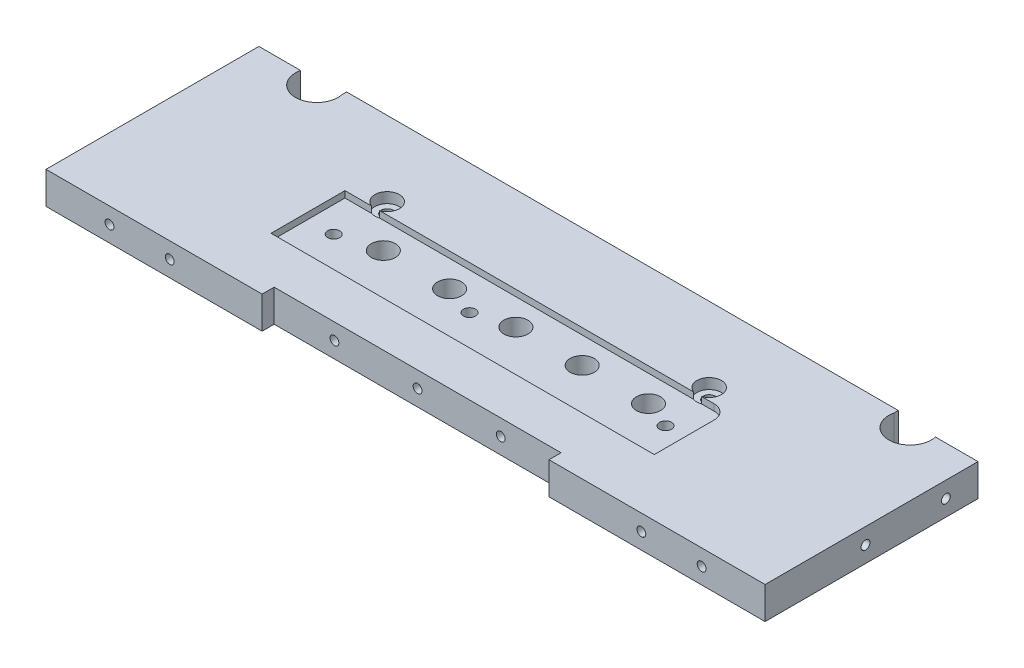
from build123d import *

# Parameters (mm, degrees)
DODANIE_WYCI_GNI_CIE1_DEPTH = 8
SZKIC7_R                    = 1.1
WYTNIJ_WYCI_GNI_CIE3_DEPTH  = 10
WYTNIJ_WYCI_GNI_CIE4_START  = -10
SZKIC8_R                    = 1.1
WYTNIJ_WYCI_GNI_CIE4_DEPTH  = 10
SZKIC9_R                    = 1.1
WYTNIJ_WYCI_GNI_CIE5_DEPTH  = 10
SZKIC11_R                   = 5.3
WYTNIJ_WYCI_GNI_CIE7_DEPTH  = 10
SZKIC12_W                   = 31
SZKIC12_H                   = 15
SZKIC12_W_2                 = 36
SZKIC12_H_2                 = 17
WYTNIJ_WYCI_GNI_CIE8_DEPTH  = 223.433017814
SZKIC13_W                   = 110.4
SZKIC13_H                   = 8
DODANIE_WYCI_GNI_CIE3_DEPTH = 5
SZKIC14_W                   = 137.340188064
SZKIC14_H                   = 8
DODANIE_WYCI_GNI_CIE4_DEPTH = 1.1
DODANIE_WYCI_GNI_CIE5_START = 0.8
SZKIC15_W                   = 53
SZKIC15_H                   = 8
SZKIC15_R                   = 1.1
DODANIE_WYCI_GNI_CIE5_DEPTH = 0.8
SZKIC16_W                   = 53
SZKIC16_H                   = 8
SZKIC16_R                   = 1.1
DODANIE_WYCI_GNI_CIE6_DEPTH = 0.8
GNIAZDO1_START              = 87.470612667
GNIAZDO1_OUTLINE_W          = 8
GNIAZDO1_OUTLINE_H          = 4.7
GNIAZDO1_DEPTH              = 1.6
GNIAZDO1_START_2            = 103.970612667
GNIAZDO1_2_OUTLINE_W        = 8
GNIAZDO1_2_OUTLINE_H        = 4.7
GNIAZDO1_2_DEPTH            = 1.6
GNIAZDO1_START_3            = 120.470612667
GNIAZDO1_3_OUTLINE_W        = 8
GNIAZDO1_3_OUTLINE_H        = 4.7
GNIAZDO1_3_DEPTH            = 1.6
GNIAZDO1_START_4            = 136.970612667
GNIAZDO1_4_OUTLINE_W        = 8
GNIAZDO1_4_OUTLINE_H        = 4.7
GNIAZDO1_4_DEPTH            = 1.6
GNIAZDO1_START_5            = 153.470612667
GNIAZDO1_5_OUTLINE_W        = 8
GNIAZDO1_5_OUTLINE_H        = 4.7
GNIAZDO1_5_DEPTH            = 1.6
SZKIC17_R                   = 3
WYTNIJ_WYCI_GNI_CIE9_DEPTH  = 8
SZKIC18_R                   = 1.5
WYTNIJ_WYCI_GNI_CIE10_DEPTH = 8
GNIAZDO2_START              = 6.4
GNIAZDO2_OUTLINE_R          = 1.5
GNIAZDO2_OUTLINE_R_2        = 3
GNIAZDO2_DEPTH              = 1.6
GNIAZDO4_OUTLINE_R          = 1.5
GNIAZDO4_OUTLINE_R_2        = 3
GNIAZDO4_DEPTH              = 1.6
WYTNIJ_WYCI_GNI_CIE11_DEPTH = 1.6
WYTNIJ_WYCI_GNI_CIE12_START = -1.6
WYTNIJ_WYCI_GNI_CIE12_DEPTH = 1.6
GNIAZDO5_START              = 22.781382309
GNIAZDO5_DEPTH              = 15
SZKIC21_W                   = 93.2
SZKIC21_H                   = 15.1
WYTNIJ_WYCI_GNI_CIE13_DEPTH = 1.5
SZKIC22_R                   = 1.5
WYTNIJ_WYCI_GNI_CIE14_DEPTH = 4.8
SZKIC26_R                   = 1.5
WYTNIJ_WYCI_GNI_CIE18_DEPTH = 8
SZKIC27_R                   = 3.05
WYTNIJ_WYCI_GNI_CIE19_DEPTH = 2.6
SZKIC28_R                   = 1.2
WYTNIJ_WYCI_GNI_CIE20_DEPTH = 13


# Read off the part's stored shape, not the designer's step: Gniazdo1, Gniazdo2, Gniazdo4, Gniazdo5
with BuildPart() as part:
    # Szkic1 → Dodanie-wyciągnięcie1 (new body)
    with BuildSketch(Plane(origin=(0, 0, 0), x_dir=(1, 0, 0), z_dir=(0, 1, 0))):
        Polygon((62.170612667, -8.881382309), (62.170612667, -28.881382309), (172.570612667, -28.881382309), (172.570612667, -6.881382309), (208.570612667, -6.881382309), (208.570612667, -76.881382309), (155.570612667, -76.881382309), (155.570612667, -73.881382309), (84.170612667, -73.881382309), (84.170612667, -76.881382309), (31.170612667, -76.881382309), (31.170612667, -8.881382309), align=None)
    extrude(amount=DODANIE_WYCI_GNI_CIE1_DEPTH)

    # Szkic7 → Wytnij-wyciągnięcie3 (cut)
    with BuildSketch(Plane(origin=(208.570612667, 0, 0), x_dir=(0, 0, -1), z_dir=(1, 0, 0))):
        with Locations((-31.881382309, 4)):
            Circle(SZKIC7_R)
        with Locations((-51.881382309, 4)):
            Circle(SZKIC7_R)
    extrude(amount=-WYTNIJ_WYCI_GNI_CIE3_DEPTH, mode=Mode.SUBTRACT)

    # Szkic8 → Wytnij-wyciągnięcie4 (cut)
    with BuildSketch(Plane.ZY.offset(-31.170612667).offset(WYTNIJ_WYCI_GNI_CIE4_START)):
        with Locations(Location((31.881382309, 4, 0), (0, 0, 180))):
            Circle(SZKIC8_R)
        with Locations(Location((51.881382309, 4, 0), (0, 0, 180))):
            Circle(SZKIC8_R)
    extrude(amount=WYTNIJ_WYCI_GNI_CIE4_DEPTH, mode=Mode.SUBTRACT)

    # Szkic9 → Wytnij-wyciągnięcie5 (cut)
    with BuildSketch(Plane.XY.offset(76.881382309)):
        with Locations((46.170612667, 4)):
            Circle(SZKIC9_R)
        with Locations((193.570612667, 4)):
            Circle(SZKIC9_R)
        with Locations((178.570612667, 4)):
            Circle(SZKIC9_R)
        with Locations((61.170612667, 4)):
            Circle(SZKIC9_R)
        with Locations((99.170612667, 4)):
            Circle(SZKIC9_R)
        with Locations((140.570612667, 4)):
            Circle(SZKIC9_R)
        with Locations((119.870612667, 4)):
            Circle(SZKIC9_R)
    extrude(amount=-WYTNIJ_WYCI_GNI_CIE5_DEPTH, mode=Mode.SUBTRACT)

    # Szkic11 → Wytnij-wyciągnięcie7 (cut)
    with BuildSketch(Plane.XZ):
        with Locations(Location((45.920612667, 25.031382309, 0), (0, 0, 270))):
            Circle(SZKIC11_R)
        with Locations(Location((193.608762528, 25.029138033, 0), (0, 0, 270))):
            Circle(SZKIC11_R)
    extrude(amount=-WYTNIJ_WYCI_GNI_CIE7_DEPTH, mode=Mode.SUBTRACT)

    # Szkic12 → Wytnij-wyciągnięcie8 (cut, through all)
    with BuildSketch(Plane(origin=(0, 8, 0), x_dir=(1, 0, 0), z_dir=(0, 1, 0))):
        with Locations((46.670612667, -16.381382309)):
            Rectangle(SZKIC12_W, SZKIC12_H)
        with Locations((190.570612667, -15.381382309)):
            Rectangle(SZKIC12_W_2, SZKIC12_H_2)
    extrude(amount=-WYTNIJ_WYCI_GNI_CIE8_DEPTH, mode=Mode.SUBTRACT)

    # Szkic13 → Dodanie-wyciągnięcie3 (add)
    with BuildSketch(Plane(origin=(0, 0, 28.881382309), x_dir=(-1, 0, 0), z_dir=(0, 0, -1))):
        with Locations((-117.370612667, 4)):
            Rectangle(SZKIC13_W, SZKIC13_H)
    extrude(amount=DODANIE_WYCI_GNI_CIE3_DEPTH)

    # Szkic14 → Dodanie-wyciągnięcie4 (add)
    with BuildSketch(Plane(origin=(0, 0, 23.881382309), x_dir=(-1, 0, 0), z_dir=(0, 0, -1))):
        with Locations((-119.764438428, 4)):
            Rectangle(SZKIC14_W, SZKIC14_H)
    extrude(amount=DODANIE_WYCI_GNI_CIE4_DEPTH)

    # Szkic15 → Dodanie-wyciągnięcie5 (add)
    with BuildSketch(Plane(origin=(208.570612667, 0, 0), x_dir=(0, 0, -1), z_dir=(1, 0, 0)).offset(DODANIE_WYCI_GNI_CIE5_START)):
        with Locations((-50.381382309, 4)):
            Rectangle(SZKIC15_W, SZKIC15_H)
        with Locations(Location((-31.881382309, 4, 0), (0, 0, 180))):
            Circle(SZKIC15_R, mode=Mode.SUBTRACT)
        with Locations(Location((-51.881382309, 4, 0), (0, 0, 180))):
            Circle(SZKIC15_R, mode=Mode.SUBTRACT)
    extrude(amount=-DODANIE_WYCI_GNI_CIE5_DEPTH)

    # Szkic16 → Dodanie-wyciągnięcie6 (add)
    with BuildSketch(Plane.ZY.offset(-31.170612667)):
        with Locations((50.381382309, 4)):
            Rectangle(SZKIC16_W, SZKIC16_H)
        with Locations(Location((31.881382309, 4, 0), (0, 0, 180))):
            Circle(SZKIC16_R, mode=Mode.SUBTRACT)
        with Locations(Location((51.881382309, 4, 0), (0, 0, 180))):
            Circle(SZKIC16_R, mode=Mode.SUBTRACT)
    extrude(amount=DODANIE_WYCI_GNI_CIE6_DEPTH)

    # Gniazdo1 outline → Gniazdo1 (cut)
    with BuildSketch(Plane.YZ.offset(GNIAZDO1_START)):
        with Locations((4, 50.811382309)):
            Rectangle(GNIAZDO1_OUTLINE_W, GNIAZDO1_OUTLINE_H)
    extrude(amount=GNIAZDO1_DEPTH, mode=Mode.SUBTRACT)

    # Gniazdo1 2 outline → Gniazdo1 2 (cut)
    with BuildSketch(Plane.YZ.offset(GNIAZDO1_START_2)):
        with Locations((4, 50.811382309)):
            Rectangle(GNIAZDO1_2_OUTLINE_W, GNIAZDO1_2_OUTLINE_H)
    extrude(amount=GNIAZDO1_2_DEPTH, mode=Mode.SUBTRACT)

    # Gniazdo1 3 outline → Gniazdo1 3 (cut)
    with BuildSketch(Plane.YZ.offset(GNIAZDO1_START_3)):
        with Locations((4, 50.811382309)):
            Rectangle(GNIAZDO1_3_OUTLINE_W, GNIAZDO1_3_OUTLINE_H)
    extrude(amount=GNIAZDO1_3_DEPTH, mode=Mode.SUBTRACT)

    # Gniazdo1 4 outline → Gniazdo1 4 (cut)
    with BuildSketch(Plane.YZ.offset(GNIAZDO1_START_4)):
        with Locations((4, 50.811382309)):
            Rectangle(GNIAZDO1_4_OUTLINE_W, GNIAZDO1_4_OUTLINE_H)
    extrude(amount=GNIAZDO1_4_DEPTH, mode=Mode.SUBTRACT)

    # Gniazdo1 5 outline → Gniazdo1 5 (cut)
    with BuildSketch(Plane.YZ.offset(GNIAZDO1_START_5)):
        with Locations((4, 50.811382309)):
            Rectangle(GNIAZDO1_5_OUTLINE_W, GNIAZDO1_5_OUTLINE_H)
    extrude(amount=GNIAZDO1_5_DEPTH, mode=Mode.SUBTRACT)

    # Szkic17 → Wytnij-wyciągnięcie9 (cut)
    with BuildSketch(Plane.XZ):
        with Locations(Location((88.270612667, 50.811382309, 0), (0, 0, 270))):
            Circle(SZKIC17_R)
        with Locations(Location((104.770612667, 50.811382309, 0), (0, 0, 270))):
            Circle(SZKIC17_R)
        with Locations(Location((121.270612667, 50.811382309, 0), (0, 0, 270))):
            Circle(SZKIC17_R)
        with Locations(Location((137.770612667, 50.811382309, 0), (0, 0, 270))):
            Circle(SZKIC17_R)
        with Locations(Location((154.270612667, 50.811382309, 0), (0, 0, 270))):
            Circle(SZKIC17_R)
    extrude(amount=-WYTNIJ_WYCI_GNI_CIE9_DEPTH, mode=Mode.SUBTRACT)

    # Szkic18 → Wytnij-wyciągnięcie10 (cut)
    with BuildSketch(Plane(origin=(0, 8, 0), x_dir=(1, 0, 0), z_dir=(0, 1, 0))):
        with Locations(Location((161.170612667, -53.461382308, 0), (0, 0, 270))):
            Circle(SZKIC18_R)
        with Locations(Location((78.570612667, -53.461382309, 0), (0, 0, 270))):
            Circle(SZKIC18_R)
    extrude(amount=-WYTNIJ_WYCI_GNI_CIE10_DEPTH, mode=Mode.SUBTRACT)

    # Gniazdo2 outline → Gniazdo2 (cut)
    with BuildSketch(Plane(origin=(0, 0, 0), x_dir=(1, 0, 0), z_dir=(0, 1, 0)).offset(GNIAZDO2_START)):
        with BuildLine():
            Line((72.370612667, -44.461382309), (72.370612667, -62.461382309))
            Line((72.370612667, -62.461382309), (167.370612667, -62.461382309))
            Line((167.370612667, -62.461382309), (167.370612667, -47.961382309))
            ThreePointArc((167.370612667, -47.961382309), (166.345486401, -45.486508575), (163.870612667, -44.461382309))
            Line((163.870612667, -44.461382309), (72.370612667, -44.461382309))
        make_face()
        with Locations((78.570612667, -53.461382309)):
            Circle(GNIAZDO2_OUTLINE_R, mode=Mode.SUBTRACT)
        with Locations((112.370612667, -53.461382309)):
            Circle(GNIAZDO2_OUTLINE_R, mode=Mode.SUBTRACT)
        with Locations((88.270612667, -50.811382309)):
            Circle(GNIAZDO2_OUTLINE_R_2, mode=Mode.SUBTRACT)
        with Locations((104.770612667, -50.811382309)):
            Circle(GNIAZDO2_OUTLINE_R_2, mode=Mode.SUBTRACT)
        with Locations((121.270612667, -50.811382309)):
            Circle(GNIAZDO2_OUTLINE_R_2, mode=Mode.SUBTRACT)
        with Locations((137.770612667, -50.811382309)):
            Circle(GNIAZDO2_OUTLINE_R_2, mode=Mode.SUBTRACT)
        with Locations((161.170612667, -53.461382308)):
            Circle(GNIAZDO2_OUTLINE_R, mode=Mode.SUBTRACT)
        with Locations((154.270612667, -50.811382309)):
            Circle(GNIAZDO2_OUTLINE_R_2, mode=Mode.SUBTRACT)
    extrude(amount=GNIAZDO2_DEPTH, mode=Mode.SUBTRACT)

    # Gniazdo4 outline → Gniazdo4 (cut)
    with BuildSketch(Plane(origin=(0, 0, 0), x_dir=(1, 0, 0), z_dir=(0, 1, 0))):
        with BuildLine():
            Line((72.370612667, -44.461382309), (72.370612667, -62.461382309))
            Line((72.370612667, -62.461382309), (167.370612667, -62.461382309))
            Line((167.370612667, -62.461382309), (167.370612667, -47.961382309))
            ThreePointArc((167.370612667, -47.961382309), (166.345486401, -45.486508575), (163.870612667, -44.461382309))
            Line((163.870612667, -44.461382309), (72.370612667, -44.461382309))
        make_face()
        with Locations((78.570612667, -53.461382309)):
            Circle(GNIAZDO4_OUTLINE_R, mode=Mode.SUBTRACT)
        with Locations((112.370612667, -53.461382309)):
            Circle(GNIAZDO4_OUTLINE_R, mode=Mode.SUBTRACT)
        with Locations((88.270612667, -50.811382309)):
            Circle(GNIAZDO4_OUTLINE_R_2, mode=Mode.SUBTRACT)
        with Locations((104.770612667, -50.811382309)):
            Circle(GNIAZDO4_OUTLINE_R_2, mode=Mode.SUBTRACT)
        with Locations((121.270612667, -50.811382309)):
            Circle(GNIAZDO4_OUTLINE_R_2, mode=Mode.SUBTRACT)
        with Locations((137.770612667, -50.811382309)):
            Circle(GNIAZDO4_OUTLINE_R_2, mode=Mode.SUBTRACT)
        with Locations((161.170612667, -53.461382308)):
            Circle(GNIAZDO4_OUTLINE_R, mode=Mode.SUBTRACT)
        with Locations((154.270612667, -50.811382309)):
            Circle(GNIAZDO4_OUTLINE_R_2, mode=Mode.SUBTRACT)
    extrude(amount=GNIAZDO4_DEPTH, mode=Mode.SUBTRACT)

    # Szkic19 → Wytnij-wyciągnięcie11 (cut)
    with BuildSketch(Plane.XZ):
        with BuildLine():
            Line((164.070612667, 44.261382309), (72.170612667, 44.261382309))
            Line((72.170612667, 44.261382309), (72.170612667, 62.661382309))
            Line((72.170612667, 62.661382309), (167.570612667, 62.661382309))
            Line((167.570612667, 62.661382309), (167.570612667, 47.761382309))
            ThreePointArc((167.570612667, 47.761382309), (166.545486401, 45.286508575), (164.070612667, 44.261382309))
        make_face()
    extrude(amount=-WYTNIJ_WYCI_GNI_CIE11_DEPTH, mode=Mode.SUBTRACT)

    # Szkic20 → Wytnij-wyciągnięcie12 (cut)
    with BuildSketch(Plane(origin=(0, 8, 0), x_dir=(1, 0, 0), z_dir=(0, 1, 0)).offset(WYTNIJ_WYCI_GNI_CIE12_START)):
        with BuildLine():
            Line((72.170612667, -44.261382309), (164.070612667, -44.261382309))
            ThreePointArc((164.070612667, -44.261382309), (166.545486401, -45.286508575), (167.570612667, -47.761382309))
            Line((167.570612667, -47.761382309), (167.570612667, -62.661382309))
            Line((167.570612667, -62.661382309), (72.170612667, -62.661382309))
            Line((72.170612667, -62.661382309), (72.170612667, -44.261382309))
        make_face()
    extrude(amount=WYTNIJ_WYCI_GNI_CIE12_DEPTH, mode=Mode.SUBTRACT)

    # Gniazdo5 outline → Gniazdo5 (cut)
    with BuildSketch(Plane.XY.offset(GNIAZDO5_START)):
        with BuildLine():
            Line((166.370612667, 0), (166.370612667, 0.5))
            ThreePointArc((166.370612667, 0.5), (166.077719448, 1.207106781), (165.370612667, 1.5))
            Line((165.370612667, 1.5), (74.370612667, 1.5))
            ThreePointArc((74.370612667, 1.5), (73.663505886, 1.207106781), (73.370612667, 0.5))
            Line((73.370612667, 0.5), (73.370612667, 0))
            Line((73.370612667, 0), (166.370612667, 0))
        make_face()
    extrude(amount=GNIAZDO5_DEPTH, mode=Mode.SUBTRACT)

    # Szkic21 → Wytnij-wyciągnięcie13 (cut)
    with BuildSketch(Plane.XZ):
        with Locations((119.870612667, 30.331382309)):
            Rectangle(SZKIC21_W, SZKIC21_H)
    extrude(amount=-WYTNIJ_WYCI_GNI_CIE13_DEPTH, mode=Mode.SUBTRACT)

    # Szkic22 → Wytnij-wyciągnięcie14 (cut)
    with BuildSketch(Plane(origin=(0, 6.4, 0), x_dir=(1, 0, 0), z_dir=(0, 1, 0))):
        with Locations(Location((112.370612667, -53.461382309, 0), (0, 0, 180))):
            Circle(SZKIC22_R)
    extrude(amount=-WYTNIJ_WYCI_GNI_CIE14_DEPTH, mode=Mode.SUBTRACT)

    # Szkic26 → Wytnij-wyciągnięcie18 (cut)
    with BuildSketch(Plane.XZ):
        with Locations(Location((79.790612667, 41.381382309, 0), (0, 0, 270))):
            Circle(SZKIC26_R)
        with Locations(Location((159.950612667, 41.381382309, 0), (0, 0, 270))):
            Circle(SZKIC26_R)
    extrude(amount=-WYTNIJ_WYCI_GNI_CIE18_DEPTH, mode=Mode.SUBTRACT)

    # Szkic27 → Wytnij-wyciągnięcie19 (cut)
    with BuildSketch(Plane(origin=(0, 8, 0), x_dir=(1, 0, 0), z_dir=(0, 1, 0))):
        with Locations(Location((79.790612667, -41.381382309, 0), (0, 0, 270))):
            Circle(SZKIC27_R)
        with Locations(Location((159.950612667, -41.381382309, 0), (0, 0, 270))):
            Circle(SZKIC27_R)
    extrude(amount=-WYTNIJ_WYCI_GNI_CIE19_DEPTH, mode=Mode.SUBTRACT)

    # Szkic28 → Wytnij-wyciągnięcie20 (cut)
    with BuildSketch(Plane(origin=(0, 0, 22.781382309), x_dir=(-1, 0, 0), z_dir=(0, 0, -1))):
        with Locations((-159.950612667, 4)):
            Circle(SZKIC28_R)
        with Locations((-79.790612667, 4)):
            Circle(SZKIC28_R)
    extrude(amount=-WYTNIJ_WYCI_GNI_CIE20_DEPTH, mode=Mode.SUBTRACT)


solid = part.part
